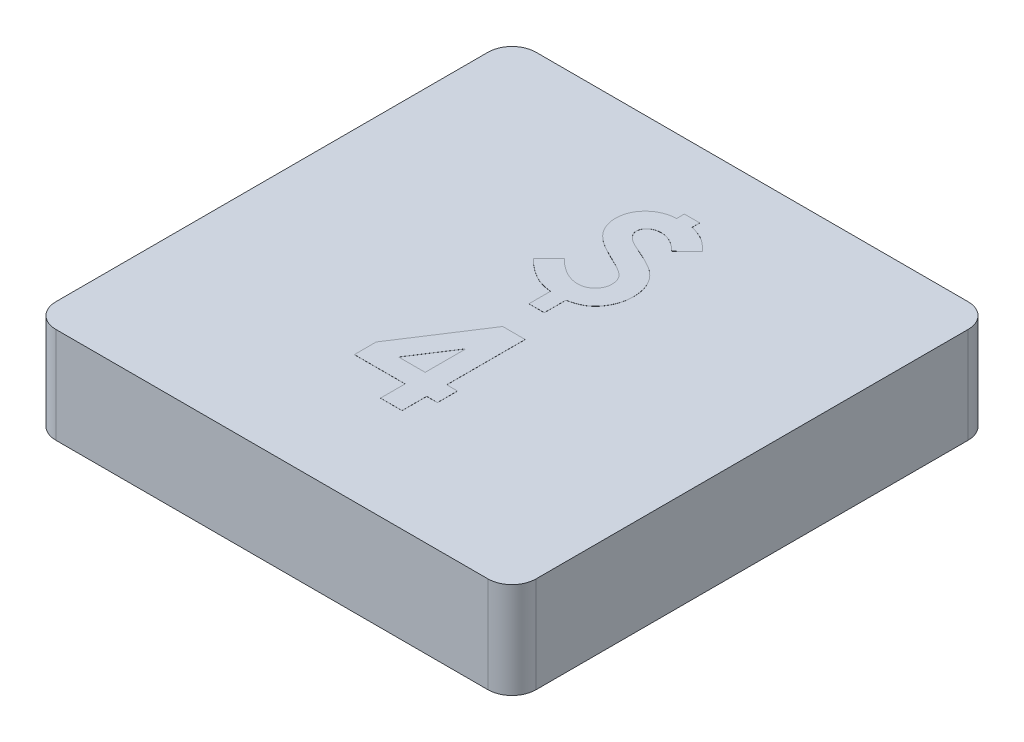
from build123d import *

# Parameters (mm, degrees)
SKETCH1_W           = 12.7
SKETCH1_H           = 12.7
BOSS_EXTRUDE1_DEPTH = 2.54
FILLET1_R           = 0.635
SHELL1_START        = 0.635
SHELL1_OUTLINE_W    = 1.905
SHELL1_OUTLINE_H    = 11.43
SHELL1_DEPTH        = 11.43
SKETCH2_R           = 2.54
BOSS_EXTRUDE2_DEPTH = 1.905
BOSS_EXTRUDE4_DEPTH = 0.00254


# Read off the part's stored shape, not the designer's step: Shell1
with BuildPart() as part:
    # Sketch1 → Boss-Extrude1 (new body)
    with BuildSketch(Plane(origin=(0, 0, 0), x_dir=(1, 0, 0), z_dir=(0, 1, 0))):
        with Locations((6.35, 6.35)):
            Rectangle(SKETCH1_W, SKETCH1_H)
    extrude(amount=BOSS_EXTRUDE1_DEPTH)

    # Fillet1
    fillet1_edges = [part.edges().sort_by_distance(p)[0] for p in [
        (0, 1.27, -12.7),
        (12.7, 1.27, -12.7),
        (12.7, 1.27, 0),
        (0, 1.27, 0),
    ]]
    fillet(fillet1_edges, radius=FILLET1_R)

    # Shell1 outline → Shell1 (cut)
    with BuildSketch(Plane.YZ.offset(SHELL1_START)):
        with Locations((0.9525, -6.35)):
            Rectangle(SHELL1_OUTLINE_W, SHELL1_OUTLINE_H)
    extrude(amount=SHELL1_DEPTH, mode=Mode.SUBTRACT)

    # Sketch2 → Boss-Extrude2 (add)
    with BuildSketch(Plane(origin=(0, 1.905, 0), x_dir=(-1, 0, 0), z_dir=(0, -1, 0))):
        with Locations(Location((-6.35, 6.35, 0), (0, 0, 270))):
            Circle(SKETCH2_R)
    extrude(amount=BOSS_EXTRUDE2_DEPTH)

    # Sketch4 → Boss-Extrude4 (add)
    # profile 1 of 2: a face of its own
    with BuildSketch(Plane(origin=(0, 2.54, 0), x_dir=(1, 0, 0), z_dir=(0, 1, 0))):
        Polygon((6.480510817, 5.974210256), (7.074551282, 5.974210256), (7.074551282, 3.898248718), (7.359487179, 3.898248718), (7.359487179, 3.369082051), (7.074551282, 3.369082051), (7.074551282, 2.7178), (6.504679487, 2.7178), (6.504679487, 3.369082051), (5.161410256, 3.369082051), (5.161410256, 3.94595004), align=None)
        Polygon((6.504679487, 3.898248718), (6.504679487, 4.978842668), (5.801880008, 3.898248718), align=None, mode=Mode.SUBTRACT)
    # profile 2 of 2: a face of its own
    with BuildSketch(Plane(origin=(0, 2.54, 0), x_dir=(1, 0, 0), z_dir=(0, 1, 0))):
        with BuildLine():
            Line((7.406984976, 10.335998798), (6.991665465, 9.935307692))
            add(Edge.make_bspline(
                [(6.991665465, 9.935307692), (6.968220024, 9.957896469), (6.922854486, 10.001604413), (6.851968783, 10.059827369), (6.781357064, 10.108976166), (6.711092446, 10.149588351), (6.640799627, 10.181124743), (6.570421611, 10.203546558), (6.500157891, 10.217583932), (6.453231922, 10.219364448), (6.430061899, 10.22024359)],
                knots=[0, 0, 0, 0, 1.208861562, 2.33907556, 3.402820298, 4.400980881, 5.349191832, 6.258141005, 7.139945025, 8, 8, 8, 8], degree=3))
            add(Edge.make_bspline(
                [(6.430061899, 10.22024359), (6.403899471, 10.219170975), (6.353552661, 10.217106842), (6.281800477, 10.200625662), (6.218083395, 10.171963441), (6.162978001, 10.1335672), (6.118660061, 10.08737089), (6.085670238, 10.036873816), (6.065418702, 9.982146492), (6.063012994, 9.944162193), (6.061807692, 9.92513141)],
                knots=[0, 0, 0, 0, 1.198011544, 2.305445805, 3.348962256, 4.381113563, 5.363569282, 6.263566672, 7.130017225, 8, 8, 8, 8], degree=3))
            add(Edge.make_bspline(
                [(6.061807692, 9.92513141), (6.062942346, 9.908653977), (6.065271259, 9.874833543), (6.08412075, 9.82517461), (6.11232136, 9.775299071), (6.138383978, 9.745137076), (6.152122196, 9.729237981)],
                knots=[0, 0, 0, 0, 0.894516561, 1.836022459, 2.859316659, 4, 4, 4, 4], degree=3))
            add(Edge.make_bspline(
                [(6.152122196, 9.729237981), (6.160244287, 9.720816207), (6.177567552, 9.702853763), (6.208320254, 9.677594331), (6.244828496, 9.652473945), (6.286427709, 9.626009569), (6.334076496, 9.599858268), (6.386982478, 9.572031842), (6.4461068, 9.54521439), (6.487487603, 9.527340869), (6.508928085, 9.518080128)],
                knots=[0, 0, 0, 0, 0.672423156, 1.434182798, 2.28314655, 3.220082228, 4.268069212, 5.407712864, 6.656867891, 8, 8, 8, 8], degree=3))
            add(Edge.make_bspline(
                [(6.508928085, 9.518080128), (6.547123945, 9.501624615), (6.620529049, 9.470000279), (6.725949021, 9.423048644), (6.821745388, 9.377334714), (6.908362629, 9.333599875), (6.985371716, 9.291637921), (7.053234273, 9.251918102), (7.110960799, 9.212858211), (7.176358415, 9.165369813), (7.245332068, 9.101127918), (7.319697388, 9.019919388), (7.382052409, 8.929969443), (7.434496037, 8.833656469), (7.475970735, 8.730809102), (7.506000976, 8.621840061), (7.524224787, 8.506579255), (7.526188983, 8.42758935), (7.527192308, 8.387240785)],
                knots=[0, 0, 0, 0, 1.218452834, 2.341632252, 3.380669879, 4.327878116, 5.183951769, 5.949833714, 6.63028248, 7.225317665, 8.315786147, 9.384546881, 10.445973047, 11.51321668, 12.591625589, 13.68712373, 14.81856753, 16, 16, 16, 16], degree=3))
            add(Edge.make_bspline(
                [(7.527192308, 8.387240785), (7.525940527, 8.346682546), (7.523476092, 8.266833747), (7.504812176, 8.149311253), (7.472571433, 8.036846212), (7.429153295, 7.929917836), (7.374984908, 7.831254365), (7.31426383, 7.741649541), (7.245676289, 7.662999272), (7.181542739, 7.60682825), (7.126266053, 7.566022086), (7.079408572, 7.539362519), (7.029180829, 7.512893987), (6.974279808, 7.488884305), (6.915217227, 7.466725999), (6.851680833, 7.446436031), (6.784149797, 7.427141632), (6.737109705, 7.416846646), (6.713089744, 7.411589744)],
                knots=[0, 0, 0, 0, 1.398055402, 2.752413464, 4.089819795, 5.424146338, 6.722736095, 7.963569404, 9.149738937, 10.309787565, 10.896110825, 11.515406893, 12.166006826, 12.853269453, 13.579614796, 14.340134636, 15.152427224, 16, 16, 16, 16], degree=3))
            Line((6.713089744, 7.411589744), (6.713089744, 6.841717949))
            Line((6.713089744, 6.841717949), (6.306038462, 6.841717949))
            Line((6.306038462, 6.841717949), (6.306038462, 7.411589744))
            add(Edge.make_bspline(
                [(6.306038462, 7.411589744), (6.260932407, 7.417508865), (6.173627208, 7.428965643), (6.048973026, 7.459844727), (5.933431761, 7.497036363), (5.863209037, 7.532393856), (5.82902524, 7.549605569)],
                knots=[0, 0, 0, 0, 1.092056374, 2.113733945, 3.081782489, 4, 4, 4, 4], degree=3))
            add(Edge.make_bspline(
                [(5.82902524, 7.549605569), (5.784421922, 7.575319651), (5.694521215, 7.627147952), (5.567652028, 7.720202965), (5.443690251, 7.822749518), (5.367680431, 7.900192292), (5.329115385, 7.939484375)],
                knots=[0, 0, 0, 0, 0.970088211, 1.955271939, 2.962567826, 4, 4, 4, 4], degree=3))
            Line((5.329115385, 7.939484375), (5.73807472, 8.347807692))
            add(Edge.make_bspline(
                [(5.73807472, 8.347807692), (5.770276914, 8.315531916), (5.832553047, 8.253113482), (5.930208341, 8.170258717), (6.026937688, 8.099683859), (6.123133593, 8.042123916), (6.21841229, 7.996807875), (6.313137257, 7.964752249), (6.40716107, 7.944584507), (6.469824943, 7.942018876), (6.500659856, 7.94075641)],
                knots=[0, 0, 0, 0, 1.232518957, 2.38358023, 3.459285847, 4.467107529, 5.410929513, 6.306558082, 7.166710731, 8, 8, 8, 8], degree=3))
            add(Edge.make_bspline(
                [(6.500659856, 7.94075641), (6.530935033, 7.942287354), (6.590433781, 7.945296064), (6.676251693, 7.970961733), (6.754438188, 8.014226678), (6.824451013, 8.071818039), (6.882924302, 8.140474874), (6.926114925, 8.217254316), (6.952937787, 8.300259042), (6.955847074, 8.357998183), (6.957320513, 8.387240785)],
                knots=[0, 0, 0, 0, 1.025332292, 2.015049702, 3.006124463, 4.038216902, 5.073984904, 6.04617681, 7.010465453, 8, 8, 8, 8], degree=3))
            add(Edge.make_bspline(
                [(6.957320513, 8.387240785), (6.95646201, 8.411933563), (6.954785019, 8.460168152), (6.938095616, 8.529934505), (6.911632454, 8.595452748), (6.88533712, 8.634212047), (6.872094151, 8.653732171)],
                knots=[0, 0, 0, 0, 1.039339221, 2.030233321, 3.007977686, 4, 4, 4, 4], degree=3))
            add(Edge.make_bspline(
                [(6.872094151, 8.653732171), (6.85460202, 8.673362669), (6.816189839, 8.716470638), (6.740466296, 8.774265663), (6.645219094, 8.832335499), (6.573483267, 8.868013356), (6.535004808, 8.887150641)],
                knots=[0, 0, 0, 0, 0.762317005, 1.674024744, 2.752367564, 4, 4, 4, 4], degree=3))
            add(Edge.make_bspline(
                [(6.535004808, 8.887150641), (6.494507252, 8.906433078), (6.416597652, 8.943528822), (6.304602291, 8.997049085), (6.203256868, 9.048626278), (6.112557984, 9.097686427), (6.03159058, 9.142731993), (5.960729388, 9.184249859), (5.900795306, 9.224016823), (5.83450108, 9.27124253), (5.764387026, 9.331778858), (5.691098847, 9.407825341), (5.628662473, 9.487993783), (5.578981708, 9.573423124), (5.539805424, 9.661899474), (5.512543165, 9.753617062), (5.495251156, 9.847946671), (5.493048251, 9.91191248), (5.491935897, 9.944211939)],
                knots=[0, 0, 0, 0, 1.361149963, 2.618593809, 3.766618961, 4.811512794, 5.747589985, 6.578416214, 7.302870291, 7.929605856, 9.047509489, 10.107720061, 11.130736737, 12.122694611, 13.099282469, 14.059974503, 15.020386449, 16, 16, 16, 16], degree=3))
            add(Edge.make_bspline(
                [(5.491935897, 9.944211939), (5.492688489, 9.970752491), (5.494175897, 10.023206783), (5.505434517, 10.100481592), (5.522750824, 10.175049255), (5.548766759, 10.246263408), (5.581362042, 10.314610672), (5.620802687, 10.380506472), (5.6682686, 10.442870868), (5.722186861, 10.501770993), (5.78128424, 10.555933143), (5.844845686, 10.604219102), (5.912333412, 10.645653847), (5.983778264, 10.680011213), (6.058992906, 10.707624067), (6.137825565, 10.728257196), (6.220507462, 10.743532862), (6.277140501, 10.747424489), (6.306038462, 10.749410256)],
                knots=[0, 0, 0, 0, 1.004170626, 1.984625641, 2.949958411, 3.896703334, 4.847824684, 5.812490235, 6.7978582, 7.808834457, 8.831147227, 9.827755371, 10.825493475, 11.823199312, 12.823418834, 13.853042784, 14.904478961, 16, 16, 16, 16], degree=3))
            Line((6.306038462, 10.749410256), (6.306038462, 10.952935897))
            Line((6.306038462, 10.952935897), (6.713089744, 10.952935897))
            Line((6.713089744, 10.952935897), (6.713089744, 10.749410256))
            add(Edge.make_bspline(
                [(6.713089744, 10.749410256), (6.746474507, 10.740874198), (6.811234543, 10.724315883), (6.903809354, 10.69417972), (6.987944372, 10.65820288), (7.067293727, 10.617748164), (7.145681965, 10.56733025), (7.227556159, 10.503669804), (7.31605682, 10.425644759), (7.375483722, 10.367055847), (7.406984976, 10.335998798)],
                knots=[0, 0, 0, 0, 1.007023709, 1.953432773, 2.841901989, 3.678835315, 4.553739984, 5.561316369, 6.707292646, 8, 8, 8, 8], degree=3))
        make_face()
    extrude(amount=BOSS_EXTRUDE4_DEPTH)


solid = part.part
